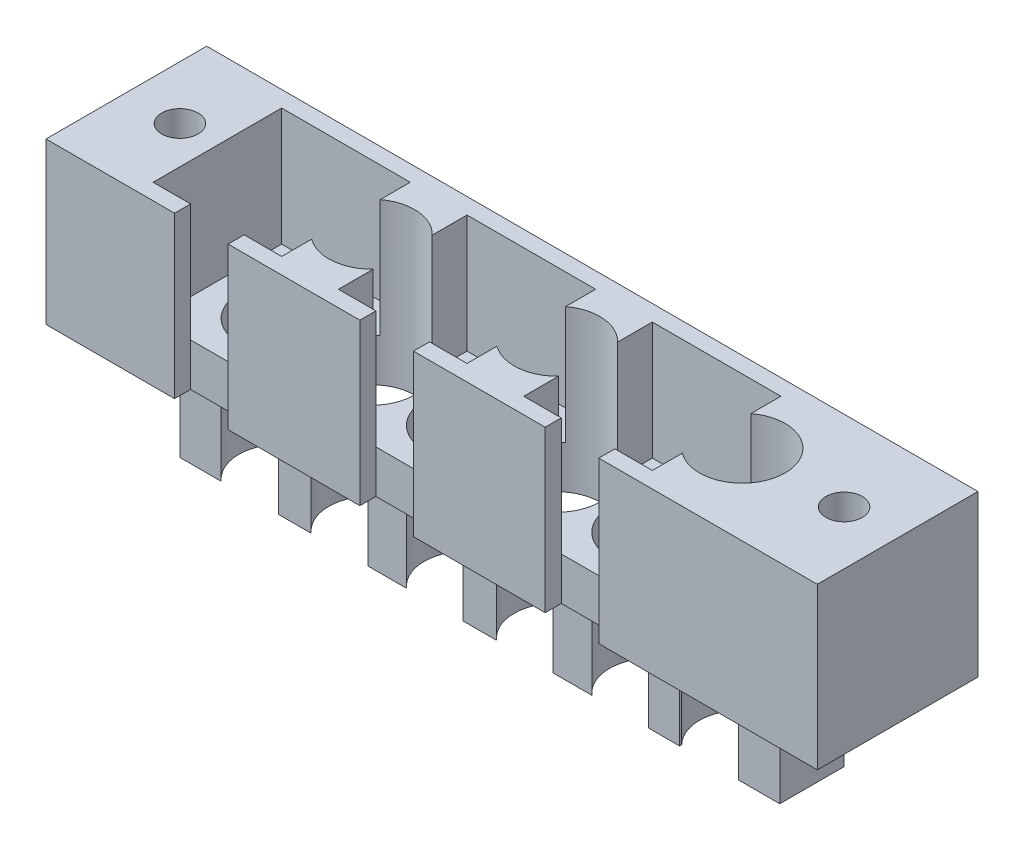
from build123d import *
from build123d.topology import SkipClean

# Parameters (mm, degrees)
SKETCH1_W             = 12
SKETCH1_H             = 12
SKETCH1_R             = 4
BOSS_EXTRUDE1_DEPTH   = 4
BOSS_EXTRUDE1_2_DEPTH = 4
BOSS_EXTRUDE1_3_DEPTH = 4
SKETCH1_3_R           = 1.7
BOSS_EXTRUDE2_DEPTH   = 15
SKETCH4_R             = 4
CUT_EXTRUDE1_DEPTH    = 63.45480038
CUT_EXTRUDE2_DEPTH    = 1
BOSS_EXTRUDE4_DEPTH   = 9


with BuildPart() as part:
    # Sketch1 → Boss-Extrude1 (new body)
    with BuildSketch(Plane(origin=(0, 0, 0), x_dir=(1, 0, 0), z_dir=(0, 1, 0))):
        with Locations((32.434732638, -17.272355561)):
            Rectangle(SKETCH1_W, SKETCH1_H)
        with Locations((32.434732638, -17.272355561)):
            Circle(SKETCH1_R, mode=Mode.SUBTRACT)
    extrude(amount=BOSS_EXTRUDE1_DEPTH)



with BuildPart() as body_2:
    # Sketch1 → Boss-Extrude1 2 (new body)
    with BuildSketch(Plane(origin=(0, 0, 0), x_dir=(1, 0, 0), z_dir=(0, 1, 0))):
        with Locations((15.134732638, -17.272354652)):
            Rectangle(SKETCH1_W, SKETCH1_H)
        with Locations((15.134732638, -17.272354652)):
            Circle(SKETCH1_R, mode=Mode.SUBTRACT)
    extrude(amount=BOSS_EXTRUDE1_2_DEPTH)


with BuildPart() as body_3:
    # Sketch1 → Boss-Extrude1 3 (new body)
    with BuildSketch(Plane(origin=(0, 0, 0), x_dir=(1, 0, 0), z_dir=(0, 1, 0))):
        with Locations((-2.165268271, -17.272354652)):
            Rectangle(SKETCH1_W, SKETCH1_H)
        with Locations((-2.165268271, -17.272354652)):
            Circle(SKETCH1_R, mode=Mode.SUBTRACT)
    extrude(amount=BOSS_EXTRUDE1_3_DEPTH)


with BuildPart() as part_1:
    add(part.part)

    add(body_2.part)  # Boss-Extrude2 merges body 2

    add(body_3.part)  # Boss-Extrude2 merges body 3
    # Sketch1<3> → Boss-Extrude2 (add)
    with BuildSketch(Plane(origin=(0, 0, 0), x_dir=(1, 0, 0), z_dir=(0, 1, 0))):
        Polygon((34.934732638, -24.772354652), (55.334731729, -24.772354652), (55.334731729, -9.772354652), (-16.665268271, -9.772354652), (-16.665268271, -24.772354652), (-4.665268271, -24.772354652), (-4.665268271, -23.272354652), (-8.165268271, -23.272354652), (-8.165268271, -11.272354652), (3.834731729, -11.272354652), (3.834731729, -23.272354652), (0.334731729, -23.272354652), (0.334731729, -24.772354652), (12.634732638, -24.772354652), (12.634732638, -23.272354652), (9.134732638, -23.272354652), (9.134732638, -11.272354652), (21.134732638, -11.272354652), (21.134732638, -23.272354652), (17.634732638, -23.272354652), (17.634732638, -24.772354652), (29.934732638, -24.772354652), (29.934732638, -23.272355561), (26.434732638, -23.272355561), (26.434732638, -11.272355561), (38.434732638, -11.272355561), (38.434732638, -23.272355561), (34.934732638, -23.272355561), align=None)
        with Locations((-11.665268271, -17.272354652)):
            Circle(SKETCH1_3_R, mode=Mode.SUBTRACT)
        with Locations((50.334731729, -17.272354652)):
            Circle(SKETCH1_3_R, mode=Mode.SUBTRACT)
    extrude(amount=BOSS_EXTRUDE2_DEPTH)

    # Sketch4 → Cut-Extrude1 (cut, through all)
    with BuildSketch(Plane(origin=(0, 15, 0), x_dir=(1, 0, 0), z_dir=(0, 1, 0))):
        with Locations((6.234731729, -17.272354652)):
            Circle(SKETCH4_R)
        with Locations((23.534732638, -17.272354652)):
            Circle(SKETCH4_R)
        with Locations((40.834732638, -17.272354652)):
            Circle(SKETCH4_R)
    extrude(amount=-CUT_EXTRUDE1_DEPTH, mode=Mode.SUBTRACT)

    # Sketch3 → Cut-Extrude2 (cut)
    # profile 1 of 3: a face of its own
    with BuildSketch(Plane.XZ):
        Polygon((-13.748180739, 23.672817735), (-12.201385867, 23.672817735), (-12.201385867, 23.347176709), (-13.463244841, 23.347176709), (-13.463244841, 22.370253632), (-12.201385867, 22.370253632), (-12.201385867, 22.044612607), (-13.463244841, 22.044612607), (-13.463244841, 20.497817735), (-13.748180739, 20.497817735), align=None)
    # profile 2 of 3: a face of its own
    with BuildSketch(Plane.XZ):
        Polygon((-11.241635266, 23.672817735), (-10.654590995, 23.672817735), (-10.654590995, 20.497817735), (-10.939526892, 20.497817735), (-10.939526892, 23.347176709), (-11.427988431, 23.347176709), align=None)
    # profile 3 of 3: a face of its own
    with BuildSketch(Plane.XZ):
        with BuildLine():
            add(Edge.make_bspline(
                [(-9.474142277, 22.0840457), (-9.473844718, 22.134934044), (-9.473266704, 22.233785387), (-9.466836494, 22.377825741), (-9.456154576, 22.512954003), (-9.441515674, 22.639176642), (-9.42370122, 22.756526242), (-9.399920029, 22.864689201), (-9.372875558, 22.964166129), (-9.341531554, 23.055281416), (-9.306164059, 23.139262618), (-9.267670123, 23.217662622), (-9.224522059, 23.290362804), (-9.17918586, 23.358523514), (-9.129826338, 23.421029008), (-9.077848149, 23.478761995), (-9.02122259, 23.530388176), (-8.961874575, 23.577420179), (-8.899266783, 23.618649342), (-8.835183793, 23.654964755), (-8.769184518, 23.68598892), (-8.701088766, 23.710382387), (-8.631508589, 23.730530798), (-8.56020075, 23.744309344), (-8.487047512, 23.752978825), (-8.437670425, 23.753807652), (-8.412628856, 23.754227991)],
                knots=[0, 0, 0, 0, 1.646270934, 3.197905019, 4.663502075, 6.030701355, 7.308322542, 8.50163776, 9.611534131, 10.641858119, 11.616356847, 12.558055219, 13.465016945, 14.349605745, 15.204443733, 16.039544428, 16.859896111, 17.680448484, 18.487036065, 19.28249412, 20.06191084, 20.843045899, 21.620316918, 22.403196591, 23.190181807, 24, 24, 24, 24], degree=3))
            add(Edge.make_bspline(
                [(-8.412628856, 23.754227991), (-8.3873781, 23.753785473), (-8.337162292, 23.752905444), (-8.26292138, 23.744447296), (-8.190395598, 23.730412778), (-8.119894143, 23.710527322), (-8.050837905, 23.685856958), (-7.983767021, 23.654935073), (-7.918264883, 23.618940672), (-7.855372408, 23.576646155), (-7.79439915, 23.529490804), (-7.736842783, 23.476184669), (-7.68269807, 23.417265995), (-7.631285471, 23.353365162), (-7.584063608, 23.283256549), (-7.539093423, 23.208159535), (-7.498841648, 23.126760822), (-7.460075192, 23.04041854), (-7.426613426, 22.94674365), (-7.396436189, 22.846264189), (-7.372053125, 22.737793319), (-7.351742856, 22.621900154), (-7.336008558, 22.49815908), (-7.324548947, 22.366835351), (-7.318495505, 22.227842568), (-7.317355498, 22.132812233), (-7.316770482, 22.0840457)],
                knots=[0, 0, 0, 0, 0.810914788, 1.612654377, 2.396697861, 3.181598691, 3.963628158, 4.749916497, 5.551656086, 6.361998678, 7.18212741, 8.025565596, 8.878627764, 9.750805457, 10.657531673, 11.591944965, 12.560506719, 13.57287815, 14.630710178, 15.753379473, 16.941251878, 18.199788006, 19.531962791, 20.947069417, 22.433333509, 24, 24, 24, 24], degree=3))
            add(Edge.make_bspline(
                [(-7.316770482, 22.0840457), (-7.317361562, 22.035491869), (-7.318513258, 21.94088671), (-7.324481085, 21.802519325), (-7.336236415, 21.671892529), (-7.35094119, 21.548693038), (-7.371307421, 21.433433626), (-7.39634925, 21.325715448), (-7.424153471, 21.225073326), (-7.458475035, 21.132331747), (-7.496040465, 21.04619697), (-7.536911964, 20.965763199), (-7.580699592, 20.890319491), (-7.628405097, 20.820469721), (-7.67925355, 20.755719082), (-7.734333258, 20.697210524), (-7.792091575, 20.643534272), (-7.853244266, 20.595771724), (-7.917117602, 20.553966222), (-7.982394765, 20.516579372), (-8.050233977, 20.48643257), (-8.11909787, 20.460547212), (-8.189971459, 20.440771088), (-8.262766399, 20.427096947), (-8.337112413, 20.41750677), (-8.387369547, 20.416775178), (-8.412628856, 20.416407479)],
                knots=[0, 0, 0, 0, 1.561518951, 3.042555995, 4.452378317, 5.7783523, 7.031515105, 8.214008947, 9.334062868, 10.386615937, 11.391082383, 12.354592575, 13.286541444, 14.194233754, 15.072674879, 15.931287219, 16.775624067, 17.606195743, 18.42308326, 19.229000347, 20.022332153, 20.807536673, 21.593273796, 22.3848459, 23.188221202, 24, 24, 24, 24], degree=3))
            add(Edge.make_bspline(
                [(-8.412628856, 20.416407479), (-8.43766973, 20.41683053), (-8.487045448, 20.417664704), (-8.56020872, 20.426295017), (-8.631222079, 20.440170224), (-8.700435949, 20.459598143), (-8.76820543, 20.483378745), (-8.833607062, 20.514361015), (-8.897368032, 20.550042634), (-8.959318229, 20.590678481), (-9.018293547, 20.637234579), (-9.074625853, 20.688727898), (-9.126899977, 20.746443421), (-9.175553764, 20.809469823), (-9.221794544, 20.877227264), (-9.264329904, 20.95064086), (-9.303673465, 21.029419514), (-9.339635774, 21.11407219), (-9.371520633, 21.20583416), (-9.39968534, 21.305755201), (-9.421923183, 21.414717242), (-9.440957721, 21.531845139), (-9.456310554, 21.657642205), (-9.466791978, 21.792176732), (-9.47327017, 21.935364886), (-9.47384627, 22.033581038), (-9.474142277, 22.0840457)],
                knots=[0, 0, 0, 0, 0.810891512, 1.598919785, 2.382837074, 3.152667961, 3.926044502, 4.706494248, 5.493654104, 6.291793342, 7.103789334, 7.925228297, 8.761435821, 9.622817696, 10.50288917, 11.416980706, 12.369136599, 13.353924996, 14.394355917, 15.514179734, 16.714354668, 17.994756427, 19.357759367, 20.818452758, 22.365282078, 24, 24, 24, 24], degree=3))
        make_face()
        with BuildLine():
            add(Edge.make_bspline(
                [(-9.18920638, 22.085317735), (-9.189098024, 22.042909987), (-9.188887727, 21.960604875), (-9.183393888, 21.841004202), (-9.175909749, 21.729452547), (-9.166256572, 21.625808267), (-9.151921041, 21.530422185), (-9.135858454, 21.442638258), (-9.116311259, 21.36292105), (-9.093183635, 21.290723536), (-9.066841026, 21.224820452), (-9.038079278, 21.163496493), (-9.007181337, 21.106027236), (-8.972601822, 21.052928891), (-8.934941729, 21.0040283), (-8.895051701, 20.958459945), (-8.851442999, 20.917822683), (-8.791114604, 20.86908475), (-8.71147066, 20.818720965), (-8.611122104, 20.774864155), (-8.50800858, 20.747302926), (-8.438021375, 20.743797948), (-8.403088591, 20.742048504)],
                knots=[0, 0, 0, 0, 1.459021318, 2.831673884, 4.118529203, 5.306027144, 6.411944654, 7.436330062, 8.375795394, 9.233974572, 10.042671642, 10.816086306, 11.563610507, 12.285937304, 12.993564865, 13.685989202, 14.367179055, 15.041617293, 16.353048772, 17.594441528, 18.799311195, 20, 20, 20, 20], degree=3))
            add(Edge.make_bspline(
                [(-8.403088591, 20.742048504), (-8.367929846, 20.74349792), (-8.297684946, 20.746393758), (-8.195056432, 20.774332613), (-8.095424687, 20.816487124), (-8.017345141, 20.866332361), (-7.957943119, 20.913801631), (-7.915382707, 20.95427349), (-7.876319277, 20.999590599), (-7.839269681, 21.04848496), (-7.805288948, 21.101890713), (-7.774388816, 21.15955105), (-7.746191779, 21.221626089), (-7.730127144, 21.264960067), (-7.721913711, 21.287115612)],
                knots=[0, 0, 0, 0, 1.353760809, 2.704726607, 4.075137775, 5.516104923, 6.260822281, 7.007110065, 7.778089737, 8.566572457, 9.372053459, 10.217411131, 11.088608312, 12, 12, 12, 12], degree=3))
            add(Edge.make_bspline(
                [(-7.721913711, 21.287115612), (-7.712341751, 21.315445447), (-7.692906565, 21.372967161), (-7.667858741, 21.462197046), (-7.648132558, 21.555816696), (-7.63038579, 21.653266623), (-7.618272661, 21.755265495), (-7.608522859, 21.861497715), (-7.602780022, 21.972043379), (-7.60206814, 22.047150264), (-7.60170638, 22.085317735)],
                knots=[0, 0, 0, 0, 0.884706709, 1.796334032, 2.740027952, 3.714592787, 4.726048262, 5.777819803, 6.87074269, 8, 8, 8, 8], degree=3))
            add(Edge.make_bspline(
                [(-7.60170638, 22.085317735), (-7.60220548, 22.123479033), (-7.603181827, 22.19813069), (-7.606913801, 22.307457896), (-7.616550901, 22.411296508), (-7.627254387, 22.510093865), (-7.643036152, 22.603303068), (-7.660052163, 22.691704417), (-7.682913262, 22.774202732), (-7.707333344, 22.852089638), (-7.735282774, 22.924480232), (-7.76604919, 22.991712024), (-7.7989075, 23.054109596), (-7.834596532, 23.11150175), (-7.872692616, 23.164145557), (-7.91420125, 23.21098551), (-7.957475931, 23.253473331), (-8.018088664, 23.301971519), (-8.097440341, 23.351421414), (-8.196178893, 23.396928925), (-8.298931549, 23.423062162), (-8.368394611, 23.426746692), (-8.403088591, 23.428586966)],
                knots=[0, 0, 0, 0, 1.31362396, 2.569729283, 3.763502607, 4.902122613, 5.988968491, 7.01645872, 7.998833611, 8.933434873, 9.825090667, 10.667526885, 11.477055099, 12.250526234, 12.991942729, 13.710640831, 14.402115721, 15.076753259, 16.378508321, 17.609869233, 18.806226677, 20, 20, 20, 20], degree=3))
            add(Edge.make_bspline(
                [(-8.403088591, 23.428586966), (-8.438204628, 23.426744153), (-8.508500676, 23.423055172), (-8.61232132, 23.397026292), (-8.711838839, 23.351657387), (-8.79098068, 23.301807735), (-8.851635687, 23.254329409), (-8.894346416, 23.213157412), (-8.934393301, 23.168121167), (-8.971284714, 23.118770858), (-9.005837135, 23.065734418), (-9.037569911, 23.00859461), (-9.066160632, 22.947061872), (-9.092544461, 22.881188392), (-9.115742633, 22.808997106), (-9.134877871, 22.729378091), (-9.152555412, 22.641873374), (-9.165069692, 22.545970678), (-9.17619467, 22.442300439), (-9.183344179, 22.3304703), (-9.188906105, 22.210669041), (-9.189104283, 22.127938376), (-9.18920638, 22.085317735)],
                knots=[0, 0, 0, 0, 1.207732386, 2.417664972, 3.655092373, 4.956220595, 5.625982001, 6.301752483, 6.994047911, 7.697131622, 8.419323945, 9.170223765, 9.943494443, 10.752040957, 11.610060368, 12.549350801, 13.567764191, 14.679664412, 15.874934091, 17.154273443, 18.533957287, 20, 20, 20, 20], degree=3))
        make_face(mode=Mode.SUBTRACT)
    extrude(amount=-CUT_EXTRUDE2_DEPTH, mode=Mode.SUBTRACT)

    # Sketch5 → Boss-Extrude4 (add)
    with SkipClean():  # the faces are left unmerged after this step: merging them gives an invalid solid
        with BuildSketch(Plane.XZ):
            with BuildLine():
                ThreePointArc((0.556835133, 20.203250942), (1.834731729, 17.272354652), (0.556835133, 14.341458362))
                Line((0.556835133, 14.341458362), (0.556835133, 14.272354652))
                Line((0.556835133, 14.272354652), (3.588980418, 14.272354652))
                ThreePointArc((3.588980418, 14.272354652), (2.234731729, 17.272354652), (3.588980418, 20.272354652))
                Line((3.588980418, 20.272354652), (0.556835133, 20.272354652))
                Line((0.556835133, 20.272354652), (0.556835133, 20.203250942))
            make_face()
            with BuildLine():
                Line((-8.668139711, 14.272354652), (-4.811019582, 14.272354652))
                ThreePointArc((-4.811019582, 14.272354652), (-6.165268271, 17.272354652), (-4.811019582, 20.272354652))
                Line((-4.811019582, 20.272354652), (-8.668139711, 20.272354652))
                Line((-8.668139711, 20.272354652), (-8.668139711, 14.272354652))
            make_face()
            with BuildLine():
                ThreePointArc((8.88048304, 20.272354652), (10.234731729, 17.272354652), (8.88048304, 14.272354652))
                Line((8.88048304, 14.272354652), (12.488981327, 14.272354652))
                ThreePointArc((12.488981327, 14.272354652), (11.134732638, 17.272354652), (12.488981327, 20.272354652))
                Line((12.488981327, 20.272354652), (8.88048304, 20.272354652))
            make_face()
            with BuildLine():
                ThreePointArc((17.780483949, 20.272354652), (19.134732638, 17.272354652), (17.780483949, 14.272354652))
                Line((17.780483949, 14.272354652), (20.888981327, 14.272354652))
                ThreePointArc((20.888981327, 14.272354652), (19.534732638, 17.272354652), (20.888981327, 20.272354652))
                Line((20.888981327, 20.272354652), (17.780483949, 20.272354652))
            make_face()
            with BuildLine():
                ThreePointArc((26.180483949, 20.272354652), (27.534732638, 17.272354652), (26.180483949, 14.272354652))
                Line((26.180483949, 14.272354652), (29.788982357, 14.272354652))
                ThreePointArc((29.788982357, 14.272354652), (28.434732638, 17.272354187), (29.788980297, 20.272354652))
                Line((29.788980297, 20.272354652), (26.180483949, 20.272354652))
            make_face()
            with BuildLine():
                ThreePointArc((35.080484979, 20.272354652), (36.434732638, 17.272354187), (35.080482919, 14.272354652))
                Line((35.080482919, 14.272354652), (37.980901679, 14.272354652))
                Line((37.980901679, 14.272354652), (37.980901679, 14.469561607))
                ThreePointArc((37.980901679, 14.469561607), (36.834732638, 17.272354652), (37.980901679, 20.075147697))
                Line((37.980901679, 20.075147697), (37.980901679, 20.272354652))
                Line((37.980901679, 20.272354652), (35.080484979, 20.272354652))
            make_face()
            with BuildLine():
                ThreePointArc((43.480483949, 20.272354652), (44.834732638, 17.272354652), (43.480483949, 14.272354652))
                Line((43.480483949, 14.272354652), (47.330399458, 14.272354652))
                Line((47.330399458, 14.272354652), (47.330399458, 20.272354652))
                Line((47.330399458, 20.272354652), (43.480483949, 20.272354652))
            make_face()
        extrude(amount=BOSS_EXTRUDE4_DEPTH)


solid = part_1.part
